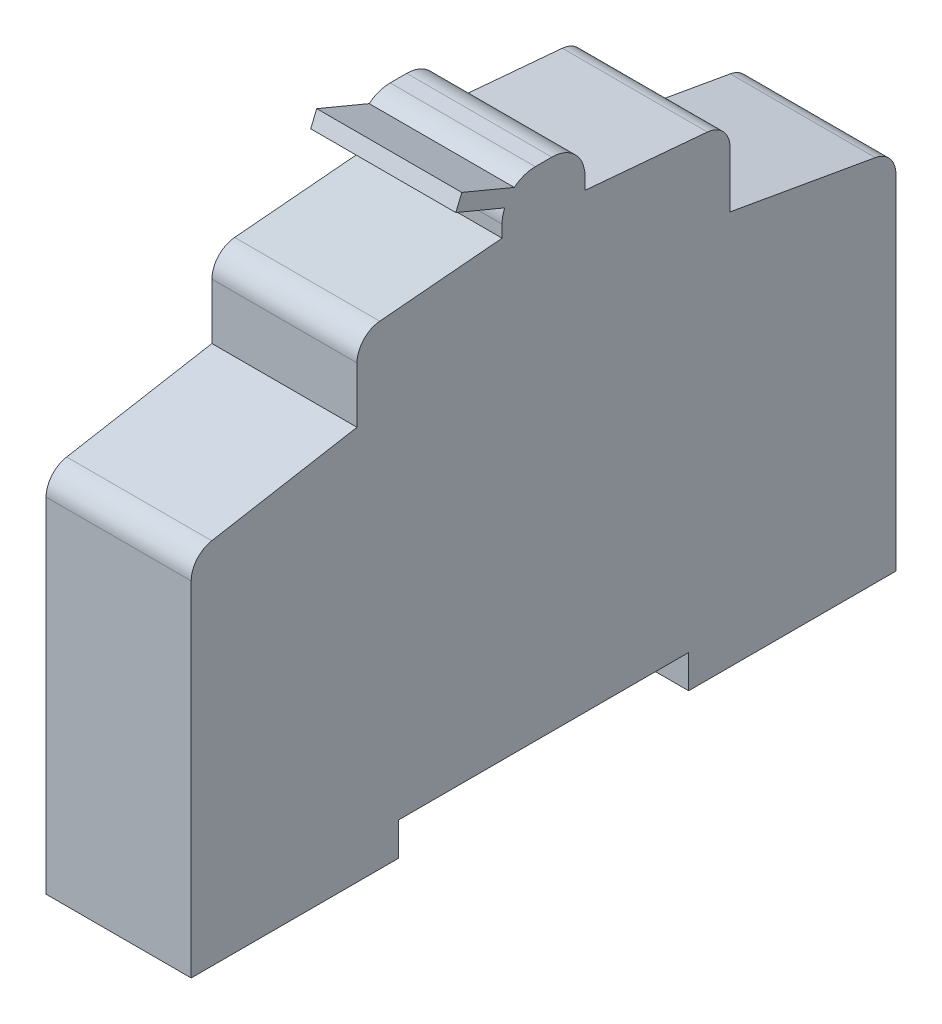
from build123d import *

# Parameters (mm, degrees)
SKETCH_1_W          = 17.5
SKETCH_1_H          = 85
EXTRUDE_1_DEPTH     = 44
SKETCH_2_W          = 17.5
SKETCH_2_H          = 45
EXTRUDE_2_DEPTH     = 15
EXTRUDE_3_DEPTH     = 5
CHAMFER_1_SIZE2     = 3.526539614
CHAMFER_1_SIZE      = 20
CHAMFER_2_SIZE2     = 3.526539614
CHAMFER_2_SIZE      = 20
CHAMFER_3_SIZE      = 2
CHAMFER_3_SIZE_2    = 22.860104606
CHAMFER_4_SIZE      = 2
CHAMFER_4_SIZE_2    = 22.860104606
FILLET_START        = -1
FILLET_1_DEPTH      = 19
FILLET_2_R          = 4
EXTRUDE_5_DEPTH     = 17.5
CUT_EXTRUDE_1_REACH = 110.872
SKETCH_6_W          = 35
SKETCH_6_H          = 4


with BuildPart() as part:
    # Эскиз1 → Бобышка-Вытянуть1 (new body)
    with BuildSketch(Plane(origin=(0, 0, 0), x_dir=(1, 0, 0), z_dir=(0, 1, 0))):
        with Locations((8.75, 42.5)):
            Rectangle(SKETCH_1_W, SKETCH_1_H)
    extrude(amount=EXTRUDE_1_DEPTH)

    # Эскиз2 → Бобышка-Вытянуть2 (add)
    with BuildSketch(Plane(origin=(0, 44, 0), x_dir=(1, 0, 0), z_dir=(0, 1, 0))):
        with Locations((8.75, 42.5)):
            Rectangle(SKETCH_2_W, SKETCH_2_H)
    extrude(amount=EXTRUDE_2_DEPTH)

    # Эскиз3 → Бобышка-Вытянуть3 (add)
    with BuildSketch(Plane(origin=(0, 59, 0), x_dir=(1, 0, 0), z_dir=(0, 1, 0))):
        Polygon((17.5, 42.5), (17.5, 47.5), (0, 47.5), (0, 42.5), (0, 37.5), (17.5, 37.5), align=None)
    extrude(amount=EXTRUDE_3_DEPTH)

    # Фаска1
    chamfer_1_edges = [part.edges().sort_by_distance(p)[0] for p in [
        (8.75, 44, -65),
    ]]
    chamfer_1_side = [part.faces().sort_by_distance(p)[0] for p in [
        (8.75, 44, -65.070530792),
    ]]
    chamfer(chamfer_1_edges, length=CHAMFER_1_SIZE - 0.0001, length2=CHAMFER_1_SIZE2 - 0.0001, reference=chamfer_1_side[0])  # a hair under: the kernel refuses the full size

    # Фаска2
    chamfer_2_edges = [part.edges().sort_by_distance(p)[0] for p in [
        (8.75, 44, -20),
    ]]
    chamfer_2_side = [part.faces().sort_by_distance(p)[0] for p in [
        (8.75, 44, -19.929469208),
    ]]
    chamfer(chamfer_2_edges, length=CHAMFER_2_SIZE - 0.0001, length2=CHAMFER_2_SIZE2 - 0.0001, reference=chamfer_2_side[0])  # a hair under: the kernel refuses the full size

    # Фаска3
    # the kernel refuses this chamfer: 22.860104606, 2 mm, written as the material it takes off along each edge
    with BuildSketch(Plane(origin=(-59.427907001, 59, -65), x_dir=(0, -1, 0), z_dir=(1, 0, 0))) as chamfer_3_piece_1_section:
        Polygon((CHAMFER_3_SIZE, 0), (0, -CHAMFER_3_SIZE_2), (0, 0), align=None)
    chamfer_3_piece_1 = extrude(amount=136.355814002, mode=Mode.PRIVATE)
    chamfer_3_piece_1 = split(chamfer_3_piece_1, bisect_by=Plane(origin=(-59.427907001, 59, -47.5), z_dir=(0, 0, -1)), keep=Keep.TOP, mode=Mode.PRIVATE)
    add(chamfer_3_piece_1, mode=Mode.SUBTRACT)

    # Фаска4
    # the kernel refuses this chamfer: 22.860104606, 2 mm, written as the material it takes off along each edge
    with BuildSketch(Plane(origin=(76.927907001, 59, -20), x_dir=(0, -1, 0), z_dir=(-1, 0, 0))) as chamfer_4_piece_1_section:
        Polygon((CHAMFER_4_SIZE, 0), (0, -CHAMFER_4_SIZE_2), (0, 0), align=None)
    chamfer_4_piece_1 = extrude(amount=136.355814002, mode=Mode.PRIVATE)
    chamfer_4_piece_1 = split(chamfer_4_piece_1, bisect_by=Plane(origin=(76.927907001, 59, -37.5), z_dir=(0, 0, 1)), keep=Keep.TOP, mode=Mode.PRIVATE)
    add(chamfer_4_piece_1, mode=Mode.SUBTRACT)

    # Скругление1: read off the stored shape, not the designer's step
    # Скругление1 outline → Скругление1 (cut)
    with BuildSketch(Plane.YZ.offset(FILLET_START)):
        with BuildLine():
            Line((44, 0), (41.482701106, 0))
            ThreePointArc((41.482701106, 0), (43.411063935, -0.701866671), (44.437124366, -2.479055467))
            Line((44.437124366, -2.479055467), (44, 0))
        make_face()
        with BuildLine():
            Line((57, -20), (54.251006478, -20))
            ThreePointArc((54.251006478, -20), (56.277777101, -20.78816799), (57.239590572, -22.738532772))
            Line((57.239590572, -22.738532772), (57, -20))
        make_face()
        with BuildLine():
            Line((57, -65), (57.239590572, -62.261467228))
            ThreePointArc((57.239590572, -62.261467228), (56.277777101, -64.21183201), (54.251006478, -65))
            Line((54.251006478, -65), (57, -65))
        make_face()
        with BuildLine():
            Line((44, -85), (44.437124366, -82.520944533))
            ThreePointArc((44.437124366, -82.520944533), (43.411063935, -84.298133329), (41.482701106, -85))
            Line((41.482701106, -85), (44, -85))
        make_face()
    extrude(amount=FILLET_1_DEPTH, mode=Mode.SUBTRACT)

    # Скругление2
    fillet_2_edges = [part.edges().sort_by_distance(p)[0] for p in [
        (8.75, 64, -47.5),
        (8.75, 64, -37.5),
    ]]
    fillet(fillet_2_edges, radius=FILLET_2_R)

    # Эскиз5 → Бобышка-Вытянуть5 (add)
    with BuildSketch(Plane.ZY):
        Polygon((-37.808562445, 61.540548206), (-31.915262461, 64), (-32.641917341, 65.741199076), (-39.550806856, 62.857911145), (-38.824151977, 61.11671207), align=None)
    extrude(amount=-EXTRUDE_5_DEPTH)

    # Эскиз6 → Вырез-Вытянуть1 (cut, up to next)
    with BuildSketch(Plane(origin=(17.5, 0, 0), x_dir=(0, 0, -1), z_dir=(1, 0, 0)), mode=Mode.PRIVATE) as cut_extrude_1_sk1:
        with Locations((42.5, 2)):
            Rectangle(SKETCH_6_W, SKETCH_6_H)
    cut_extrude_1_tool1 = extrude(cut_extrude_1_sk1.sketch, amount=-CUT_EXTRUDE_1_REACH, mode=Mode.PRIVATE) & part.part
    add(cut_extrude_1_tool1.solids().sort_by_distance((17.5, 2, -42.5))[0], mode=Mode.SUBTRACT)


solid = part.part
